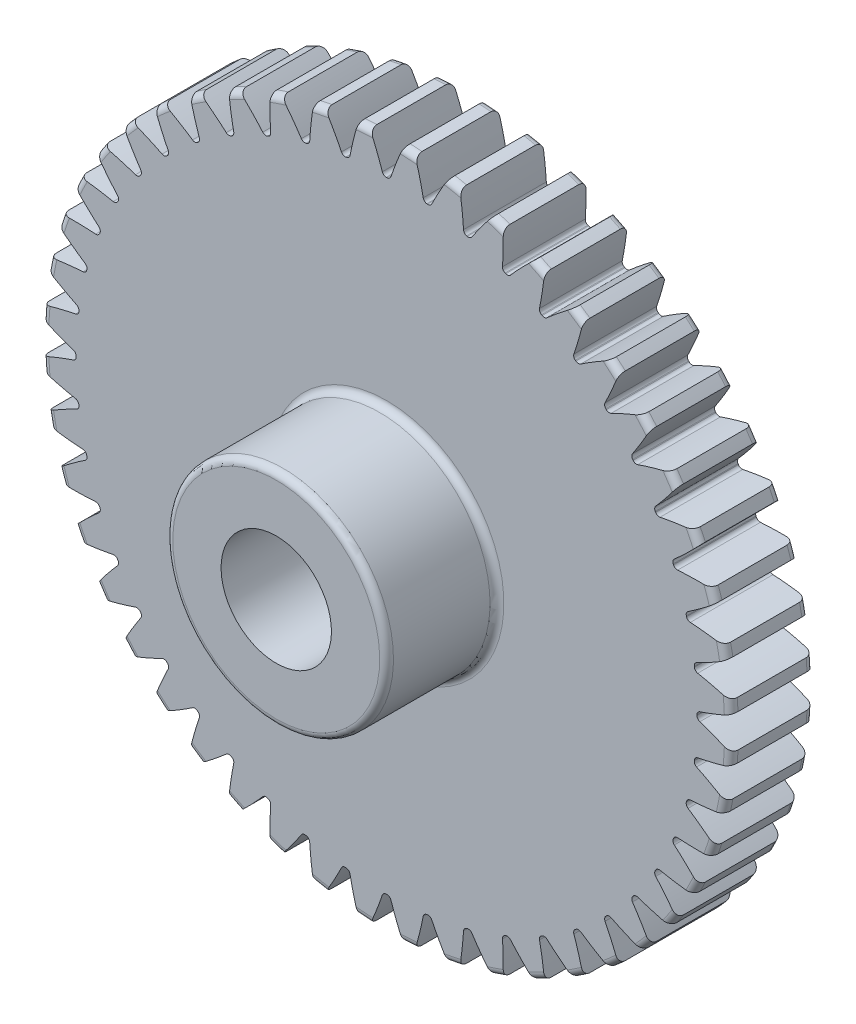
from build123d import *

# Parameters (mm, degrees)
FILLET2_R          = 0.5
CUT_EXTRUDE2_DEPTH = 37.24913799
CIRPATTERN1_COUNT  = 48


with BuildPart() as part:
    # Sketch4 → Revolve1 (revolve)
    with BuildSketch(Plane(origin=(0, 0, 0), x_dir=(0, 0, -1), z_dir=(1, 0, 0))):
        Polygon((-14, 4), (-14, 8), (-6, 8), (-6, 25), (0, 25), (0, 4), align=None)
    revolve(axis=Axis((0, 0, 6), (0, 0, 1)))

    # Fillet2
    fillet2_edges = [part.edges().sort_by_distance(p)[0] for p in [
        (0, -8, 14),
        (0, -8, 6),
        (0, -25, 6),
        (0, -25, 0),
    ]]
    fillet(fillet2_edges, radius=FILLET2_R)

    # Sketch7 → Cut-Extrude2 (cut, through all)
    with BuildSketch(Plane.XY.offset(6)):
        with BuildLine():
            ThreePointArc((-0.027461051, 22.499983242), (0, 22.5), (0.027461051, 22.499983242))
            ThreePointArc((0.027461051, 22.499983242), (0.202731788, 22.556239605), (0.312161304, 22.704259166))
            ThreePointArc((0.312161304, 22.704259166), (0.730259175, 23.848927802), (1.205921567, 24.970898125))
            ThreePointArc((1.205921567, 24.970898125), (0, 25), (-1.205921567, 24.970898125))
            ThreePointArc((-1.205921567, 24.970898125), (-0.730259175, 23.848927802), (-0.312161304, 22.704259166))
            ThreePointArc((-0.312161304, 22.704259166), (-0.202731788, 22.556239605), (-0.027461051, 22.499983242))
        make_face()
    cut_extrude2 = extrude(amount=-CUT_EXTRUDE2_DEPTH, mode=Mode.SUBTRACT)

    # CirPattern1: Cut-Extrude2 ×48 about axis
    cirpattern1_axis = Axis((0, 0, 14), (0, 0, -1))
    for i in range(1, CIRPATTERN1_COUNT):
        add(cut_extrude2.rotate(cirpattern1_axis, i * 360 / CIRPATTERN1_COUNT), mode=Mode.SUBTRACT)


solid = part.part
